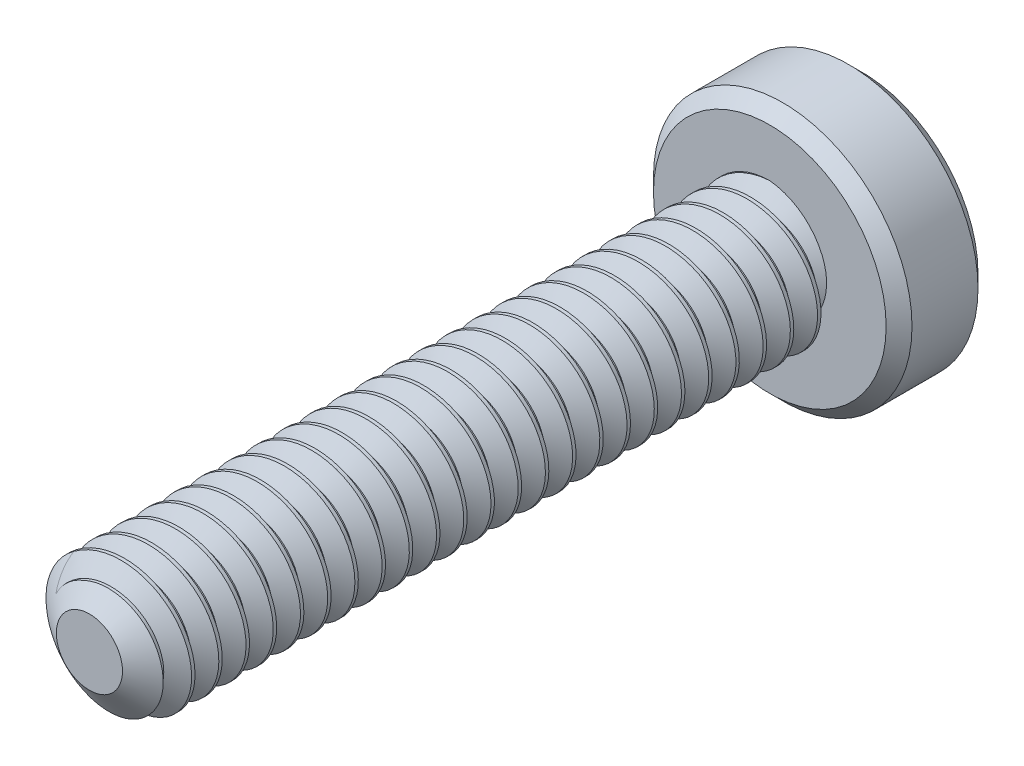
from build123d import *

# Parameters (mm, degrees)
SKETCH1_R          = 1
EXTRUDE1_DEPTH     = 10
CUT_SWEEP1_PITCH   = 0.4
SKETCH6_R          = 1.9
EXTRUDE2_DEPTH     = 1.35
CUT_EXTRUDE1_DEPTH = 0.975
CHAMFER1_SIZE      = 0.19


with BuildPart() as part:
    # Sketch1 → Extrude1 (new body)
    with BuildSketch(Plane.XY):
        Circle(SKETCH1_R)
    extrude(amount=-EXTRUDE1_DEPTH)

    # Cut-Sweep1: the profile of Sketch3 profile screwed along a right-hand helix of 26 turns, 6 arcs to a turn; built about Z, then put on its axis
    cut_sweep1_z = Axis((0, 0, 0), (0, 0, 1))
    cut_sweep1_corners = [(1.0003, 0, -0.350173205), (0.740192379, 0, -0.2), (0.740192379, 0, -0.15), (1.0003, 0, 0.000173205)]
    with BuildLine(mode=Mode.PRIVATE) as cut_sweep1_profile:
        Line(cut_sweep1_corners[0], cut_sweep1_corners[1])
        Line(cut_sweep1_corners[1], cut_sweep1_corners[2])
        Line(cut_sweep1_corners[2], cut_sweep1_corners[3])
        Line(cut_sweep1_corners[3], cut_sweep1_corners[0])
    cut_sweep1_cap = Face(cut_sweep1_profile.wire())
    cut_sweep1_turn_angles = [0, 30, 60, 90, 120, 150, 180, 210, 240, 270, 300, 330, 360]
    cut_sweep1_turn_weights = [1, 0.8660254037844387, 1, 0.8660254037844387, 1, 0.8660254037844387, 1, 0.8660254037844387, 1, 0.8660254037844387, 1, 0.8660254037844387, 1]
    cut_sweep1_turn_rails = [Edge.make_bspline([Vector(p[0], p[1], 0).rotate(cut_sweep1_z, cut_sweep1_turn_angles[k]) / cut_sweep1_turn_weights[k] + Vector(0, 0, p[2] + CUT_SWEEP1_PITCH * cut_sweep1_turn_angles[k] / 360) for k in range(13)], [0, 0, 0, 1, 1, 2, 2, 3, 3, 4, 4, 5, 5, 6, 6, 6], 2, cut_sweep1_turn_weights) for p in cut_sweep1_corners]
    cut_sweep1_turn_sides = [Face.make_surface_from_curves(cut_sweep1_turn_rails[p[0]], cut_sweep1_turn_rails[p[1]]) for p in [(0, 1), (1, 2), (2, 3), (3, 0)]]
    cut_sweep1 = Plane(origin=(0, 0, 0), x_dir=(0, 1, 0), z_dir=(0, 0, -1)) * Solid(Shell([*[p.moved(Location((0, 0, CUT_SWEEP1_PITCH * i))) for i in range(26) for p in cut_sweep1_turn_sides], cut_sweep1_cap, cut_sweep1_cap.rotate(cut_sweep1_z, 9360).moved(Location((0, 0, CUT_SWEEP1_PITCH * 9360 / 360)))]))
    add(cut_sweep1, mode=Mode.SUBTRACT)

    # Sketch4 → Cut-Revolve1 (revolve, cut)
    with BuildSketch(Plane(origin=(0, 0, 0), x_dir=(0, 0, -1), z_dir=(1, 0, 0)), mode=Mode.PRIVATE) as cut_revolve1_sk:
        Polygon((0.35977197, 1), (0, 0.486192379), (0, 1), align=None)
    revolve(cut_revolve1_sk.sketch.rotate(Axis((0, 0, 0), (0, 0, -1)), 278.428757719), axis=Axis((0, 0, 0), (0, 0, -1)), mode=Mode.SUBTRACT)

    # Sketch6 → Extrude2 (add)
    with BuildSketch(Plane(origin=(0, 0, -10), x_dir=(-1, 0, 0), z_dir=(0, 0, -1))):
        with Locations(Location((0, 0, 0), (0, 0, 180))):
            Circle(SKETCH6_R)
    extrude(amount=EXTRUDE2_DEPTH)

    # Sketch7 → Cut-Extrude1 (cut)
    with BuildSketch(Plane(origin=(0, 0, -11.35), x_dir=(-1, 0, 0), z_dir=(0, 0, -1))):
        Polygon((0, 0.75055535), (-0.65, 0.375277675), (-0.65, -0.375277675), (0, -0.75055535), (0.65, -0.375277675), (0.65, 0.375277675), align=None)
    extrude(amount=-CUT_EXTRUDE1_DEPTH, mode=Mode.SUBTRACT)

    # Cut-Extrude2 cone 1 section (through the dimple's axis) → Cut-Extrude2 (revolve, cut)
    with BuildSketch(Plane(origin=(0, 0, -11.35), x_dir=(0, 1, 0), z_dir=(1, 0, 0))):
        Polygon((0, 0), (0.75055535, 0), (0, 0.75055535), align=None)
    revolve(axis=Axis((0, 0, -11.35), (0, 0, 1)), mode=Mode.SUBTRACT)

    # Chamfer1
    chamfer1_edges = [part.edges().sort_by_distance(p)[0] for p in [
        (-1.9, 0, -10),
        (-1.9, 0, -11.35),
    ]]
    chamfer(chamfer1_edges, length=CHAMFER1_SIZE)


solid = part.part
